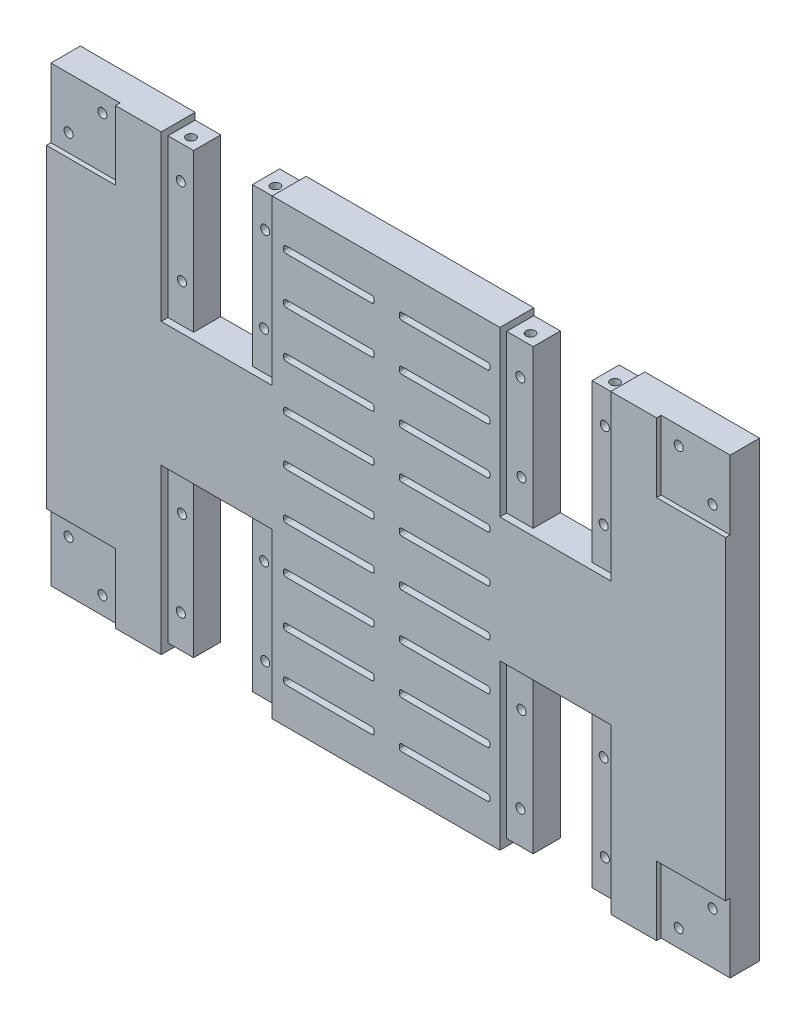
from build123d import *

# Parameters (mm, degrees)
CROQUIS1_W              = 300
CROQUIS1_H              = 200
SALIENTE_EXTRUIR1_DEPTH = 15
CROQUIS2_W              = 30.5
CROQUIS2_H              = 30.5
HUECOS_COLUMNA_DEPTH    = 2
HUECOS_MOTOR_DEPTH      = 181.900525151
CROQUIS4_R              = 2
SIDE_SCREWS_1_DEPTH     = 15
SIDE_START              = -15
CROQUIS5_R              = 2
SIDE_SCREWS_2_DEPTH     = 15
CROQUIS7_R              = 2
SCREWS_AND_VENTI_DEPTH  = 15
CROQUIS9_W              = 49
CROQUIS9_H              = 69.5
CORTAR_EXTRUIR6_DEPTH   = 3


with BuildPart() as part:
    # Croquis1 → Saliente-Extruir1 (new body)
    with BuildSketch(Plane.XY):
        Rectangle(CROQUIS1_W, CROQUIS1_H)
    extrude(amount=SALIENTE_EXTRUIR1_DEPTH)

    # Croquis2 → Huecos columna (cut)
    with BuildSketch(Plane.XY.offset(15)):
        with Locations((-134.75, 84.75)):
            Rectangle(CROQUIS2_W, CROQUIS2_H)
        with Locations((134.75, 84.75)):
            Rectangle(CROQUIS2_W, CROQUIS2_H)
        with Locations((134.75, -84.75)):
            Rectangle(CROQUIS2_W, CROQUIS2_H)
        with Locations((-134.75, -84.75)):
            Rectangle(CROQUIS2_W, CROQUIS2_H)
    extrude(amount=-HUECOS_COLUMNA_DEPTH, mode=Mode.SUBTRACT)

    # Croquis3 → huecos motor (cut, through all)
    with BuildSketch(Plane.XY.offset(15)):
        Polygon((-88, -97), (-88, -27.5), (-62, -27.5), (-62, -97), (-50.295392228, -97), (-50.295392228, -100), (-99.295392228, -100), (-99.295392228, -97), align=None)
        Polygon((88, -27.5), (62, -27.5), (62, -97), (50.295392228, -97), (50.295392228, -100), (99.295392228, -100), (99.295392228, -97), (88, -97), align=None)
        Polygon((88, 97), (88, 27.5), (62, 27.5), (62, 97), (50.295392228, 97), (50.295392228, 100), (99.295392228, 100), (99.295392228, 97), align=None)
        Polygon((-88, 27.5), (-62, 27.5), (-62, 97), (-50.295392228, 97), (-50.295392228, 100), (-99.295392228, 100), (-99.295392228, 97), (-88, 97), align=None)
    extrude(amount=-HUECOS_MOTOR_DEPTH, mode=Mode.SUBTRACT)

    # Croquis4 → side_screws 1 (cut)
    with BuildSketch(Plane.XZ.offset(97)):
        with Locations((-93.647696114, 7.5)):
            Circle(CROQUIS4_R)
        with Locations((-56.352303886, 7.5)):
            Circle(CROQUIS4_R)
        with Locations((56.352303886, 7.5)):
            Circle(CROQUIS4_R)
        with Locations((93.647696114, 7.5)):
            Circle(CROQUIS4_R)
    extrude(amount=-SIDE_SCREWS_1_DEPTH, mode=Mode.SUBTRACT)

    # Croquis5 → side screws 2 (cut)
    with BuildSketch(Plane(origin=(0, 97, 0), x_dir=(1, 0, 0), z_dir=(0, 1, 0)).offset(SIDE_START)):
        with Locations((-93.647696114, -7.5)):
            Circle(CROQUIS5_R)
        with Locations((-56.352303886, -7.5)):
            Circle(CROQUIS5_R)
        with Locations((56.352303886, -7.5)):
            Circle(CROQUIS5_R)
        with Locations((93.647696114, -7.5)):
            Circle(CROQUIS5_R)
    extrude(amount=SIDE_SCREWS_2_DEPTH, mode=Mode.SUBTRACT)

    # Croquis7 → screws and venti (cut)
    with BuildSketch(Plane.XY.offset(15)):
        with Locations((-127.278174593, -92.221825407)):
            Circle(CROQUIS7_R)
        with Locations((-142.221825407, -77.278174593)):
            Circle(CROQUIS7_R)
        with Locations((-127.278174593, 92.221825407)):
            Circle(CROQUIS7_R)
        with Locations((-142.221825407, 77.278174593)):
            Circle(CROQUIS7_R)
        with Locations((127.278174593, -92.221825407)):
            Circle(CROQUIS7_R)
        with Locations((142.221825407, -77.278174593)):
            Circle(CROQUIS7_R)
        with Locations((127.278174593, 92.221825407)):
            Circle(CROQUIS7_R)
        with Locations((142.221825407, 77.278174593)):
            Circle(CROQUIS7_R)
        with Locations((-93.647696114, -82.5)):
            Circle(CROQUIS7_R)
        with Locations((-93.147733982, -44.503289118)):
            Circle(CROQUIS7_R)
        with Locations((-56.352303886, -82.5)):
            Circle(CROQUIS7_R)
        with Locations((-56.852266018, -44.503289118)):
            Circle(CROQUIS7_R)
        with Locations((56.852266018, -44.503289118)):
            Circle(CROQUIS7_R)
        with Locations((56.352303886, -82.5)):
            Circle(CROQUIS7_R)
        with Locations((93.647696114, -82.5)):
            Circle(CROQUIS7_R)
        with Locations((93.147733982, -44.503289118)):
            Circle(CROQUIS7_R)
        with Locations((93.647696114, 82.5)):
            Circle(CROQUIS7_R)
        with Locations((93.147733982, 44.503289118)):
            Circle(CROQUIS7_R)
        with Locations((56.352303886, 82.5)):
            Circle(CROQUIS7_R)
        with Locations((56.852266018, 44.503289118)):
            Circle(CROQUIS7_R)
        with Locations((-56.352303886, 82.5)):
            Circle(CROQUIS7_R)
        with Locations((-56.852266018, 44.503289118)):
            Circle(CROQUIS7_R)
        with Locations((-93.647696114, 82.5)):
            Circle(CROQUIS7_R)
        with Locations((-93.147733982, 44.503289118)):
            Circle(CROQUIS7_R)
        with BuildLine():
            Line((6.875948392, 84), (44.875948392, 84))
            ThreePointArc((44.875948392, 84), (45.583055173, 83.707106781), (45.875948392, 83))
            Line((45.875948392, 83), (45.875948392, 82))
            ThreePointArc((45.875948392, 82), (45.583055173, 81.292893219), (44.875948392, 81))
            Line((44.875948392, 81), (6.875948392, 81))
            ThreePointArc((6.875948392, 81), (6.168841611, 81.292893219), (5.875948392, 82))
            Line((5.875948392, 82), (5.875948392, 83))
            ThreePointArc((5.875948392, 83), (6.168841611, 83.707106781), (6.875948392, 84))
        make_face()
        with BuildLine():
            Line((-44.236036181, 81), (-6.236036181, 81))
            ThreePointArc((-6.236036181, 81), (-5.5289294, 81.292893219), (-5.236036181, 82))
            Line((-5.236036181, 82), (-5.236036181, 83))
            ThreePointArc((-5.236036181, 83), (-5.5289294, 83.707106781), (-6.236036181, 84))
            Line((-6.236036181, 84), (-44.236036181, 84))
            ThreePointArc((-44.236036181, 84), (-44.943142962, 83.707106781), (-45.236036181, 83))
            Line((-45.236036181, 83), (-45.236036181, 82))
            ThreePointArc((-45.236036181, 82), (-44.943142962, 81.292893219), (-44.236036181, 81))
        make_face()
        with BuildLine():
            Line((6.875948392, 63.375), (44.875948392, 63.375))
            ThreePointArc((44.875948392, 63.375), (45.583055173, 63.082106781), (45.875948392, 62.375))
            Line((45.875948392, 62.375), (45.875948392, 61.375))
            ThreePointArc((45.875948392, 61.375), (45.583055173, 60.667893219), (44.875948392, 60.375))
            Line((44.875948392, 60.375), (6.875948392, 60.375))
            ThreePointArc((6.875948392, 60.375), (6.168841611, 60.667893219), (5.875948392, 61.375))
            Line((5.875948392, 61.375), (5.875948392, 62.375))
            ThreePointArc((5.875948392, 62.375), (6.168841611, 63.082106781), (6.875948392, 63.375))
        make_face()
        with BuildLine():
            Line((6.875948392, 42.75), (44.875948392, 42.75))
            ThreePointArc((44.875948392, 42.75), (45.583055173, 42.457106781), (45.875948392, 41.75))
            Line((45.875948392, 41.75), (45.875948392, 40.75))
            ThreePointArc((45.875948392, 40.75), (45.583055173, 40.042893219), (44.875948392, 39.75))
            Line((44.875948392, 39.75), (6.875948392, 39.75))
            ThreePointArc((6.875948392, 39.75), (6.168841611, 40.042893219), (5.875948392, 40.75))
            Line((5.875948392, 40.75), (5.875948392, 41.75))
            ThreePointArc((5.875948392, 41.75), (6.168841611, 42.457106781), (6.875948392, 42.75))
        make_face()
        with BuildLine():
            Line((6.875948392, 22.125), (44.875948392, 22.125))
            ThreePointArc((44.875948392, 22.125), (45.583055173, 21.832106781), (45.875948392, 21.125))
            Line((45.875948392, 21.125), (45.875948392, 20.125))
            ThreePointArc((45.875948392, 20.125), (45.583055173, 19.417893219), (44.875948392, 19.125))
            Line((44.875948392, 19.125), (6.875948392, 19.125))
            ThreePointArc((6.875948392, 19.125), (6.168841611, 19.417893219), (5.875948392, 20.125))
            Line((5.875948392, 20.125), (5.875948392, 21.125))
            ThreePointArc((5.875948392, 21.125), (6.168841611, 21.832106781), (6.875948392, 22.125))
        make_face()
        with BuildLine():
            Line((6.875948392, 1.5), (44.875948392, 1.5))
            ThreePointArc((44.875948392, 1.5), (45.583055173, 1.207106781), (45.875948392, 0.5))
            Line((45.875948392, 0.5), (45.875948392, -0.5))
            ThreePointArc((45.875948392, -0.5), (45.583055173, -1.207106781), (44.875948392, -1.5))
            Line((44.875948392, -1.5), (6.875948392, -1.5))
            ThreePointArc((6.875948392, -1.5), (6.168841611, -1.207106781), (5.875948392, -0.5))
            Line((5.875948392, -0.5), (5.875948392, 0.5))
            ThreePointArc((5.875948392, 0.5), (6.168841611, 1.207106781), (6.875948392, 1.5))
        make_face()
        with BuildLine():
            Line((6.875948392, -19.125), (44.875948392, -19.125))
            ThreePointArc((44.875948392, -19.125), (45.583055173, -19.417893219), (45.875948392, -20.125))
            Line((45.875948392, -20.125), (45.875948392, -21.125))
            ThreePointArc((45.875948392, -21.125), (45.583055173, -21.832106781), (44.875948392, -22.125))
            Line((44.875948392, -22.125), (6.875948392, -22.125))
            ThreePointArc((6.875948392, -22.125), (6.168841611, -21.832106781), (5.875948392, -21.125))
            Line((5.875948392, -21.125), (5.875948392, -20.125))
            ThreePointArc((5.875948392, -20.125), (6.168841611, -19.417893219), (6.875948392, -19.125))
        make_face()
        with BuildLine():
            Line((6.875948392, -39.75), (44.875948392, -39.75))
            ThreePointArc((44.875948392, -39.75), (45.583055173, -40.042893219), (45.875948392, -40.75))
            Line((45.875948392, -40.75), (45.875948392, -41.75))
            ThreePointArc((45.875948392, -41.75), (45.583055173, -42.457106781), (44.875948392, -42.75))
            Line((44.875948392, -42.75), (6.875948392, -42.75))
            ThreePointArc((6.875948392, -42.75), (6.168841611, -42.457106781), (5.875948392, -41.75))
            Line((5.875948392, -41.75), (5.875948392, -40.75))
            ThreePointArc((5.875948392, -40.75), (6.168841611, -40.042893219), (6.875948392, -39.75))
        make_face()
        with BuildLine():
            Line((6.875948392, -60.375), (44.875948392, -60.375))
            ThreePointArc((44.875948392, -60.375), (45.583055173, -60.667893219), (45.875948392, -61.375))
            Line((45.875948392, -61.375), (45.875948392, -62.375))
            ThreePointArc((45.875948392, -62.375), (45.583055173, -63.082106781), (44.875948392, -63.375))
            Line((44.875948392, -63.375), (6.875948392, -63.375))
            ThreePointArc((6.875948392, -63.375), (6.168841611, -63.082106781), (5.875948392, -62.375))
            Line((5.875948392, -62.375), (5.875948392, -61.375))
            ThreePointArc((5.875948392, -61.375), (6.168841611, -60.667893219), (6.875948392, -60.375))
        make_face()
        with BuildLine():
            Line((6.875948392, -81), (44.875948392, -81))
            ThreePointArc((44.875948392, -81), (45.583055173, -81.292893219), (45.875948392, -82))
            Line((45.875948392, -82), (45.875948392, -83))
            ThreePointArc((45.875948392, -83), (45.583055173, -83.707106781), (44.875948392, -84))
            Line((44.875948392, -84), (6.875948392, -84))
            ThreePointArc((6.875948392, -84), (6.168841611, -83.707106781), (5.875948392, -83))
            Line((5.875948392, -83), (5.875948392, -82))
            ThreePointArc((5.875948392, -82), (6.168841611, -81.292893219), (6.875948392, -81))
        make_face()
        with BuildLine():
            Line((-44.236036181, 63.375), (-6.236036181, 63.375))
            ThreePointArc((-6.236036181, 63.375), (-5.5289294, 63.082106781), (-5.236036181, 62.375))
            Line((-5.236036181, 62.375), (-5.236036181, 61.375))
            ThreePointArc((-5.236036181, 61.375), (-5.5289294, 60.667893219), (-6.236036181, 60.375))
            Line((-6.236036181, 60.375), (-44.236036181, 60.375))
            ThreePointArc((-44.236036181, 60.375), (-44.943142962, 60.667893219), (-45.236036181, 61.375))
            Line((-45.236036181, 61.375), (-45.236036181, 62.375))
            ThreePointArc((-45.236036181, 62.375), (-44.943142962, 63.082106781), (-44.236036181, 63.375))
        make_face()
        with BuildLine():
            Line((-44.236036181, 42.75), (-6.236036181, 42.75))
            ThreePointArc((-6.236036181, 42.75), (-5.5289294, 42.457106781), (-5.236036181, 41.75))
            Line((-5.236036181, 41.75), (-5.236036181, 40.75))
            ThreePointArc((-5.236036181, 40.75), (-5.5289294, 40.042893219), (-6.236036181, 39.75))
            Line((-6.236036181, 39.75), (-44.236036181, 39.75))
            ThreePointArc((-44.236036181, 39.75), (-44.943142962, 40.042893219), (-45.236036181, 40.75))
            Line((-45.236036181, 40.75), (-45.236036181, 41.75))
            ThreePointArc((-45.236036181, 41.75), (-44.943142962, 42.457106781), (-44.236036181, 42.75))
        make_face()
        with BuildLine():
            Line((-44.236036181, 22.125), (-6.236036181, 22.125))
            ThreePointArc((-6.236036181, 22.125), (-5.5289294, 21.832106781), (-5.236036181, 21.125))
            Line((-5.236036181, 21.125), (-5.236036181, 20.125))
            ThreePointArc((-5.236036181, 20.125), (-5.5289294, 19.417893219), (-6.236036181, 19.125))
            Line((-6.236036181, 19.125), (-44.236036181, 19.125))
            ThreePointArc((-44.236036181, 19.125), (-44.943142962, 19.417893219), (-45.236036181, 20.125))
            Line((-45.236036181, 20.125), (-45.236036181, 21.125))
            ThreePointArc((-45.236036181, 21.125), (-44.943142962, 21.832106781), (-44.236036181, 22.125))
        make_face()
        with BuildLine():
            Line((-44.236036181, 1.5), (-6.236036181, 1.5))
            ThreePointArc((-6.236036181, 1.5), (-5.5289294, 1.207106781), (-5.236036181, 0.5))
            Line((-5.236036181, 0.5), (-5.236036181, -0.5))
            ThreePointArc((-5.236036181, -0.5), (-5.5289294, -1.207106781), (-6.236036181, -1.5))
            Line((-6.236036181, -1.5), (-44.236036181, -1.5))
            ThreePointArc((-44.236036181, -1.5), (-44.943142962, -1.207106781), (-45.236036181, -0.5))
            Line((-45.236036181, -0.5), (-45.236036181, 0.5))
            ThreePointArc((-45.236036181, 0.5), (-44.943142962, 1.207106781), (-44.236036181, 1.5))
        make_face()
        with BuildLine():
            Line((-44.236036181, -19.125), (-6.236036181, -19.125))
            ThreePointArc((-6.236036181, -19.125), (-5.5289294, -19.417893219), (-5.236036181, -20.125))
            Line((-5.236036181, -20.125), (-5.236036181, -21.125))
            ThreePointArc((-5.236036181, -21.125), (-5.5289294, -21.832106781), (-6.236036181, -22.125))
            Line((-6.236036181, -22.125), (-44.236036181, -22.125))
            ThreePointArc((-44.236036181, -22.125), (-44.943142962, -21.832106781), (-45.236036181, -21.125))
            Line((-45.236036181, -21.125), (-45.236036181, -20.125))
            ThreePointArc((-45.236036181, -20.125), (-44.943142962, -19.417893219), (-44.236036181, -19.125))
        make_face()
        with BuildLine():
            Line((-44.236036181, -39.75), (-6.236036181, -39.75))
            ThreePointArc((-6.236036181, -39.75), (-5.5289294, -40.042893219), (-5.236036181, -40.75))
            Line((-5.236036181, -40.75), (-5.236036181, -41.75))
            ThreePointArc((-5.236036181, -41.75), (-5.5289294, -42.457106781), (-6.236036181, -42.75))
            Line((-6.236036181, -42.75), (-44.236036181, -42.75))
            ThreePointArc((-44.236036181, -42.75), (-44.943142962, -42.457106781), (-45.236036181, -41.75))
            Line((-45.236036181, -41.75), (-45.236036181, -40.75))
            ThreePointArc((-45.236036181, -40.75), (-44.943142962, -40.042893219), (-44.236036181, -39.75))
        make_face()
        with BuildLine():
            Line((-44.236036181, -60.375), (-6.236036181, -60.375))
            ThreePointArc((-6.236036181, -60.375), (-5.5289294, -60.667893219), (-5.236036181, -61.375))
            Line((-5.236036181, -61.375), (-5.236036181, -62.375))
            ThreePointArc((-5.236036181, -62.375), (-5.5289294, -63.082106781), (-6.236036181, -63.375))
            Line((-6.236036181, -63.375), (-44.236036181, -63.375))
            ThreePointArc((-44.236036181, -63.375), (-44.943142962, -63.082106781), (-45.236036181, -62.375))
            Line((-45.236036181, -62.375), (-45.236036181, -61.375))
            ThreePointArc((-45.236036181, -61.375), (-44.943142962, -60.667893219), (-44.236036181, -60.375))
        make_face()
        with BuildLine():
            Line((-44.236036181, -81), (-6.236036181, -81))
            ThreePointArc((-6.236036181, -81), (-5.5289294, -81.292893219), (-5.236036181, -82))
            Line((-5.236036181, -82), (-5.236036181, -83))
            ThreePointArc((-5.236036181, -83), (-5.5289294, -83.707106781), (-6.236036181, -84))
            Line((-6.236036181, -84), (-44.236036181, -84))
            ThreePointArc((-44.236036181, -84), (-44.943142962, -83.707106781), (-45.236036181, -83))
            Line((-45.236036181, -83), (-45.236036181, -82))
            ThreePointArc((-45.236036181, -82), (-44.943142962, -81.292893219), (-44.236036181, -81))
        make_face()
    extrude(amount=-SCREWS_AND_VENTI_DEPTH, mode=Mode.SUBTRACT)

    # Croquis9 → Cortar-Extruir6 (cut)
    with BuildSketch(Plane.XY.offset(15)):
        with Locations((-74.795392228, -62.25)):
            Rectangle(CROQUIS9_W, CROQUIS9_H)
        with Locations((74.795392228, -62.25)):
            Rectangle(CROQUIS9_W, CROQUIS9_H)
        with Locations((74.795392228, 62.25)):
            Rectangle(CROQUIS9_W, CROQUIS9_H)
        with Locations((-74.795392228, 62.25)):
            Rectangle(CROQUIS9_W, CROQUIS9_H)
    extrude(amount=-CORTAR_EXTRUIR6_DEPTH, mode=Mode.SUBTRACT)


solid = part.part
